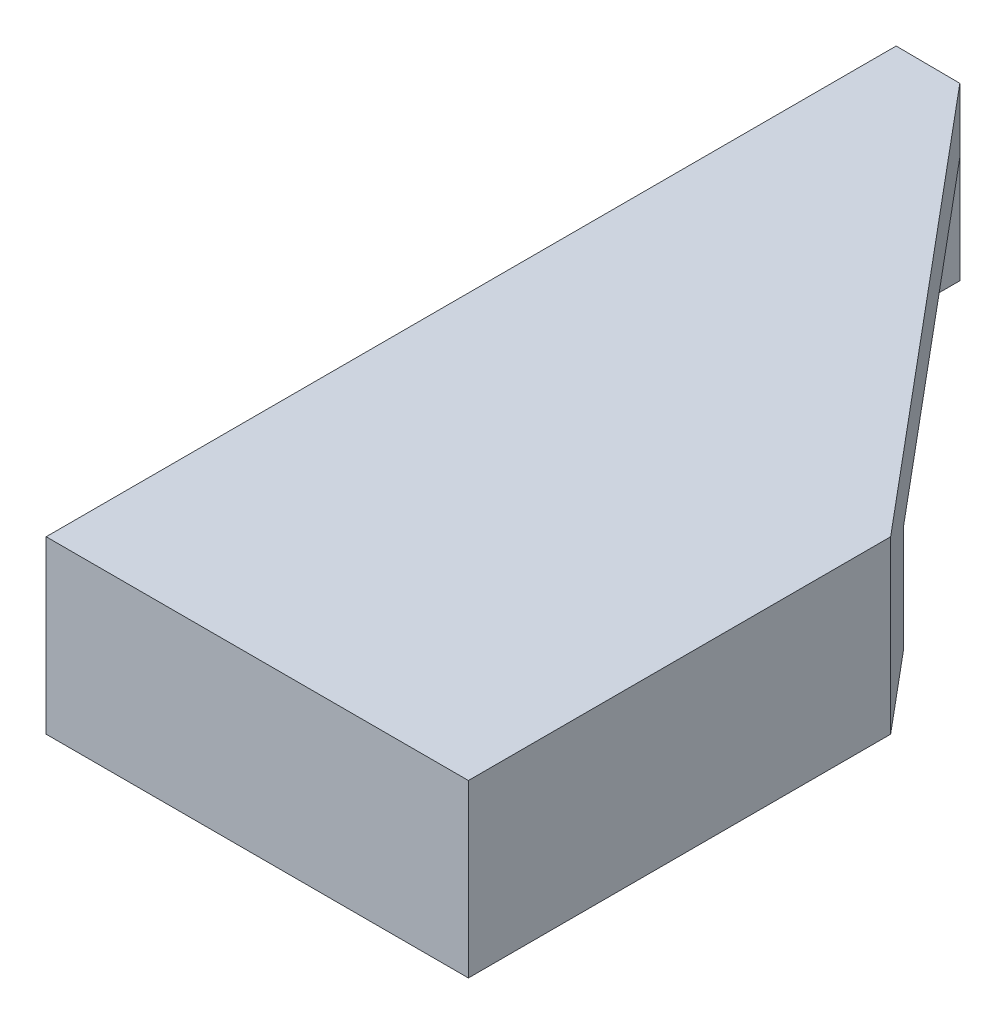
from build123d import *

# Parameters (mm, degrees)
MAINBASESKETCH_W         = 7.9
MAINBASESKETCH_H         = 3.2
MAINBASEEXTRUDE_DEPTH    = 7.9
MAINBASESHELL_T          = -1.2
SKETCH171_W              = 5.5
SKETCH171_H              = 1.191135725
BOSS_EXTRUDE23_DEPTH     = 2
CUT_EXTRUDE58_DEPTH      = 12.83470157
CUT_EXTRUDE58_DEPTH_BACK = 12.83470157
SWEEP28_DEPTH            = 3.2
PLAINHALF3_DEPTH         = 2
CUT_EXTRUDE59_DEPTH      = 13.162994561


# Read off the part's stored shape, not the designer's step: Sweep28
with BuildPart() as part:
    # MainBaseSketch → MainBaseExtrude (new, symmetric)
    with BuildSketch(Plane.XY):
        with Locations((4.631967213, 1.6)):
            Rectangle(MAINBASESKETCH_W, MAINBASESKETCH_H)
    extrude(amount=MAINBASEEXTRUDE_DEPTH, both=True)

    # MainBaseShell
    mainbaseshell_openings = [part.faces().sort_by_distance(p)[0] for p in [
        (4.631967213, 0, 0),
    ]]
    offset(amount=MAINBASESHELL_T, openings=mainbaseshell_openings, kind=Kind.INTERSECTION)

    # Sketch171 → Boss-Extrude23 (add)
    with BuildSketch(Plane(origin=(0, 2, 0), x_dir=(-1, 0, 0), z_dir=(0, -1, 0))):
        with Locations((-4.631967213, -0.595567863)):
            Rectangle(SKETCH171_W, SKETCH171_H)
    extrude(amount=BOSS_EXTRUDE23_DEPTH)

    # Sketch173 → Cut-Extrude58 (cut, two sides: drawn at the far end of the back side and taken through both)
    with BuildSketch(Plane(origin=(0, 2, 0), x_dir=(-1, 0, 0), z_dir=(0, -1, 0)).offset(-CUT_EXTRUDE58_DEPTH_BACK)):
        Polygon((-7.381967213, 0), (-8.581967213, 0), (-8.581967213, 7.9), (-0.681967213, 7.9), (-0.681967213, 0), align=None)
    extrude(amount=CUT_EXTRUDE58_DEPTH + CUT_EXTRUDE58_DEPTH_BACK, mode=Mode.SUBTRACT)

    # Sweep28 outline → Sweep28 (add)
    with BuildSketch(Plane(origin=(0, 0, 0), x_dir=(1, 0, 0), z_dir=(0, 1, 0))):
        Polygon((8.581967213, 0), (8.581967213, 8.003016647), (7.381967213, 7.994392876), (0.681967213, 0), align=None)
    extrude(amount=SWEEP28_DEPTH)

    # Sketch174 → PlainHalf3 (cut)
    with BuildSketch(Plane(origin=(0, 0, 0), x_dir=(-1, 0, 0), z_dir=(0, -1, 0))):
        Polygon((-7.381967213, 7.994392876), (-7.381967213, 1.2), (-7.381967213, 0), (-2.361390112, 0), (-2.361390112, 0.487595591), (-2.706140626, 0.958938316), (-1.846183268, 1.587930185), align=None)
    extrude(amount=-PLAINHALF3_DEPTH, mode=Mode.SUBTRACT)

    # Mirror15: part across plane


with BuildPart() as part_1:
    add(part.part)
    add(part.part.mirror(Plane.ZY.offset(-0.681967213)))

    # Sketch178 → Cut-Extrude59 (cut, through all)
    with BuildSketch(Plane(origin=(0, 0, 0), x_dir=(-1, 0, 0), z_dir=(0, -1, 0))):
        Polygon((-8.581967213, -7.9), (-0.681967213, -7.9), (-0.681967213, 0.079862465), (-7.381967213, 7.994392876), (-8.581967213, 8.003016647), align=None)
    extrude(amount=-CUT_EXTRUDE59_DEPTH, mode=Mode.SUBTRACT)


solid = part_1.part
